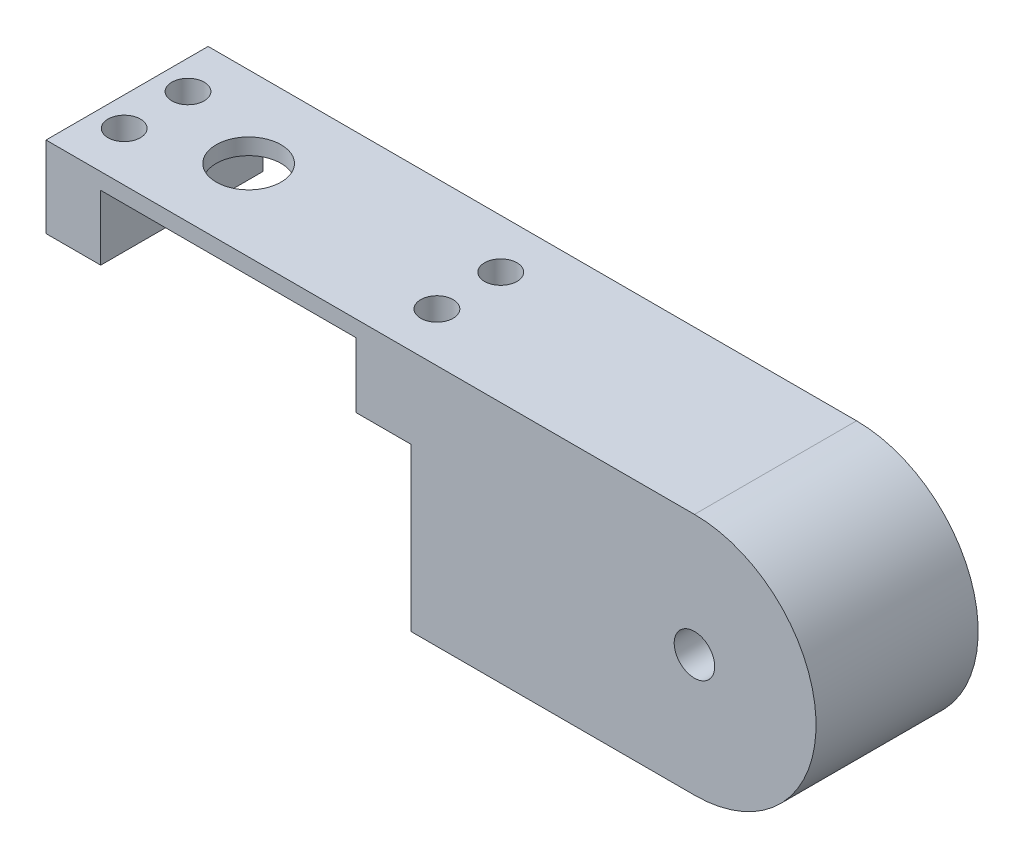
from build123d import *

# Parameters (mm, degrees)
SKETCH1_R           = 19.05
SKETCH1_W           = 101.6
SKETCH1_H           = 38.1
BOSS_EXTRUDE1_DEPTH = 25.4
SKETCH11_R          = 3.175
CUT_EXTRUDE6_DEPTH  = 77.727341932
SKETCH12_W          = 57.15
SKETCH12_H          = 35.56
CUT_EXTRUDE7_DEPTH  = 77.727341932
SKETCH13_R          = 5.08
CUT_EXTRUDE8_DEPTH  = 84.521209881
SKETCH14_W          = 8.57504
SKETCH14_H          = 11.43
BOSS_EXTRUDE2_DEPTH = 10.16
SKETCH16_R          = 2.54
CUT_EXTRUDE9_DEPTH  = 79.545162168


with BuildPart() as part:
    # Sketch1 → Boss-Extrude1 (new body)
    with BuildSketch(Plane.XY):
        with Locations((50.8, 0)):
            Circle(SKETCH1_R)
        Rectangle(SKETCH1_W, SKETCH1_H)
    extrude(amount=BOSS_EXTRUDE1_DEPTH)

    # Sketch11 → Cut-Extrude6 (cut, through all)
    with BuildSketch(Plane.XY.offset(25.4)):
        with Locations((50.8, 0)):
            Circle(SKETCH11_R)
    extrude(amount=-CUT_EXTRUDE6_DEPTH, mode=Mode.SUBTRACT)

    # Sketch12 → Cut-Extrude7 (cut, through all)
    with BuildSketch(Plane.XY.offset(25.4)):
        with Locations((-22.225, -1.27)):
            Rectangle(SKETCH12_W, SKETCH12_H)
    extrude(amount=-CUT_EXTRUDE7_DEPTH, mode=Mode.SUBTRACT)

    # Sketch13 → Cut-Extrude8 (cut, through all)
    with BuildSketch(Plane(origin=(0, 19.05, 0), x_dir=(1, 0, 0), z_dir=(0, 1, 0))):
        with Locations((-31.75, -12.7)):
            Circle(SKETCH13_R)
    extrude(amount=-CUT_EXTRUDE8_DEPTH, mode=Mode.SUBTRACT)

    # Sketch14 → Boss-Extrude2 (add)
    with BuildSketch(Plane.XZ.offset(-16.51)):
        with Locations((-46.51248, 19.685)):
            Rectangle(SKETCH14_W, SKETCH14_H)
        with Locations((2.06248, 19.685)):
            Rectangle(SKETCH14_W, SKETCH14_H)
        with Locations((2.06248, 5.715)):
            Rectangle(SKETCH14_W, SKETCH14_H)
        with Locations((-46.51248, 5.715)):
            Rectangle(SKETCH14_W, SKETCH14_H)
    extrude(amount=BOSS_EXTRUDE2_DEPTH)

    # Sketch16 → Cut-Extrude9 (cut, through all)
    with BuildSketch(Plane.XZ.offset(-6.35)):
        with Locations((-46.250098, 17.69999)):
            Circle(SKETCH16_R)
        with Locations((2.749804, 17.69999)):
            Circle(SKETCH16_R)
        with Locations((2.749804, 7.70001)):
            Circle(SKETCH16_R)
        with Locations((-46.250098, 7.70001)):
            Circle(SKETCH16_R)
    extrude(amount=-CUT_EXTRUDE9_DEPTH, mode=Mode.SUBTRACT)


solid = part.part
